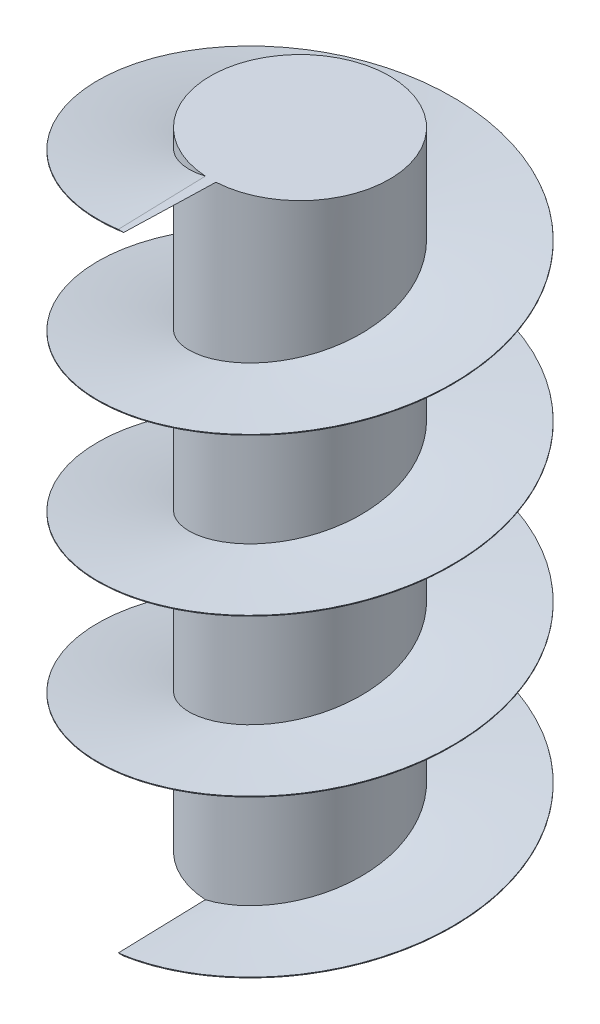
from build123d import *

# Parameters (mm, degrees)
SKETCH1_R           = 10
BOSS_EXTRUDE1_DEPTH = 70
SWEEP1_PITCH        = 17.5


with BuildPart() as part:
    # Sketch1 → Boss-Extrude1 (new body)
    with BuildSketch(Plane(origin=(0, 0, 0), x_dir=(1, 0, 0), z_dir=(0, 1, 0))):
        with Locations(Location((0, 0, 0), (0, 0, 270))):
            Circle(SKETCH1_R)
    extrude(amount=BOSS_EXTRUDE1_DEPTH)

    # Sweep1: the profile of Sketch4 screwed along a right-hand helix of 4 turns, 20 arcs to a turn; built about Z, then put on its axis
    sweep1_z = Axis((0, 0, 0), (0, 0, 1))
    sweep1_corners = [(13.927033504, -14.354014692, 0), (6.641595539, -7.475908554, 0), (7.475908554, -6.641595539, 0), (14.354014692, -13.927033504, 0)]
    with BuildLine(mode=Mode.PRIVATE) as sweep1_profile:
        Line(sweep1_corners[0], sweep1_corners[1])
        Line(sweep1_corners[2], sweep1_corners[3])
        ThreePointArc((6.641595539, -7.475908554, 0), (7.071067812, -7.071067812, 0), (7.475908554, -6.641595539, 0))
        ThreePointArc((14.354014692, -13.927033504, 0), (14.142135624, -14.142135624, 0), (13.927033504, -14.354014692, 0))
    sweep1_cap = Face(sweep1_profile.wire())
    sweep1_arcs = [((6.641595539, -7.475908554, 0), (7.083405066, -7.083405066, 0), (7.475908554, -6.641595539, 0), (1, 0.9982582877011327, 1)), ((14.354014692, -13.927033504, 0), (14.143747333, -14.143747333, 0), (13.927033504, -14.354014692, 0), (1, 0.9998860479236129, 1))]  # start, shoulder, end, weights
    sweep1_turn_angles = [0, 9, 18, 27, 36, 45, 54, 63, 72, 81, 90, 99, 108, 117, 126, 135, 144, 153, 162, 171, 180, 189, 198, 207, 216, 225, 234, 243, 252, 261, 270, 279, 288, 297, 306, 315, 324, 333, 342, 351, 360]
    sweep1_turn_weights = [1, 0.9876883405951378, 1, 0.9876883405951378, 1, 0.9876883405951378, 1, 0.9876883405951378, 1, 0.9876883405951378, 1, 0.9876883405951378, 1, 0.9876883405951378, 1, 0.9876883405951378, 1, 0.9876883405951378, 1, 0.9876883405951378, 1, 0.9876883405951378, 1, 0.9876883405951378, 1, 0.9876883405951378, 1, 0.9876883405951378, 1, 0.9876883405951378, 1, 0.9876883405951378, 1, 0.9876883405951378, 1, 0.9876883405951378, 1, 0.9876883405951378, 1, 0.9876883405951378, 1]
    sweep1_turn_rails = [Edge.make_bspline([Vector(p[0], p[1], 0).rotate(sweep1_z, sweep1_turn_angles[k]) / sweep1_turn_weights[k] + Vector(0, 0, p[2] + SWEEP1_PITCH * sweep1_turn_angles[k] / 360) for k in range(41)], [0, 0, 0, 1, 1, 2, 2, 3, 3, 4, 4, 5, 5, 6, 6, 7, 7, 8, 8, 9, 9, 10, 10, 11, 11, 12, 12, 13, 13, 14, 14, 15, 15, 16, 16, 17, 17, 18, 18, 19, 19, 20, 20, 20], 2, sweep1_turn_weights) for p in sweep1_corners]
    sweep1_turn_sides = [*[Face.make_surface_from_curves(sweep1_turn_rails[p[0]], sweep1_turn_rails[p[1]]) for p in [(0, 1), (2, 3)]], *[Face.make_bezier_surface([[Vector(p[j][0], p[j][1], 0).rotate(sweep1_z, sweep1_turn_angles[2 * i + k]) / sweep1_turn_weights[2 * i + k] + Vector(0, 0, p[j][2] + SWEEP1_PITCH * sweep1_turn_angles[2 * i + k] / 360) for k in range(3)] for j in range(3)], [[p[3][j] * sweep1_turn_weights[2 * i + k] for k in range(3)] for j in range(3)]) for p in sweep1_arcs for i in range(20)]]
    sweep1 = Plane(origin=(0, 0, 0), x_dir=(0.7071067811865438, 0, 0.7071067811865512), z_dir=(0, 1, 0)) * Solid(Shell([*[p.moved(Location((0, 0, SWEEP1_PITCH * i))) for i in range(4) for p in sweep1_turn_sides], sweep1_cap, sweep1_cap.rotate(sweep1_z, 1440).moved(Location((0, 0, SWEEP1_PITCH * 1440 / 360)))]))
    add(sweep1)


solid = part.part
